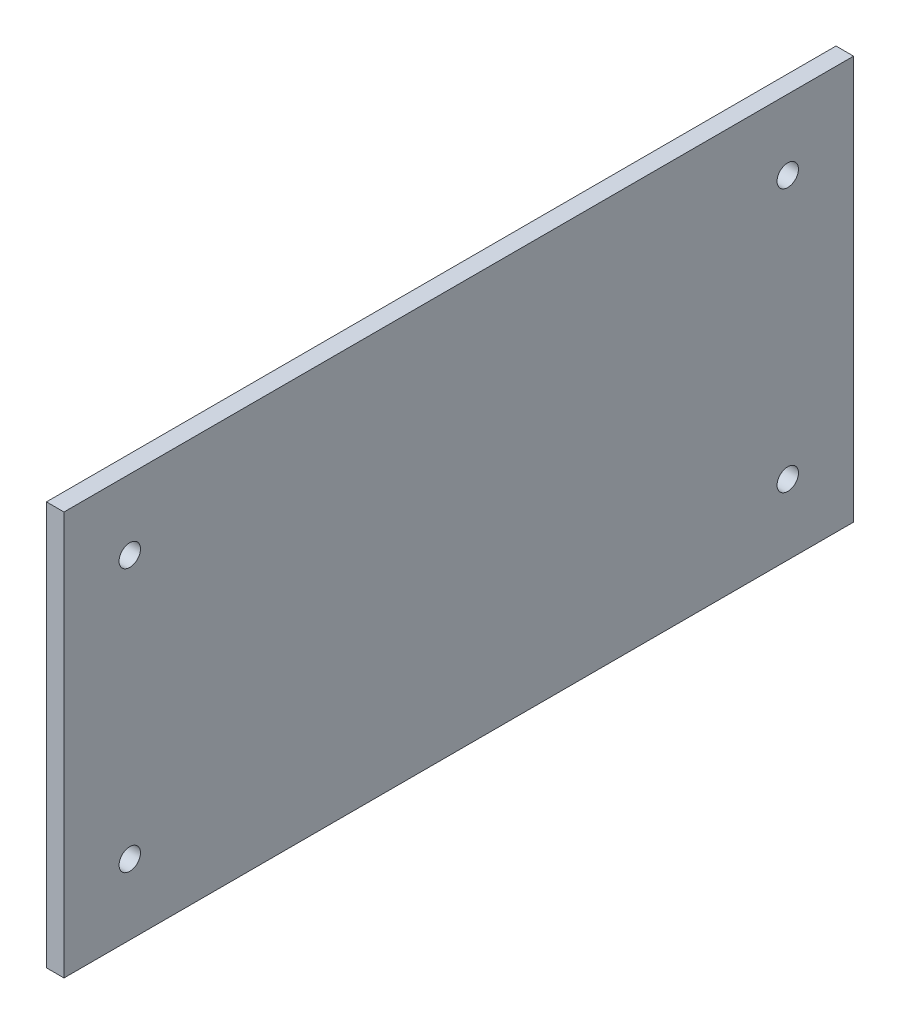
from build123d import *

# Parameters (mm, degrees)
SKETCH1_W                 = 90
SKETCH1_H                 = 46
BOSS_EXTRUDE1_DEPTH       = 2
F_2_CLEARANCE_HOLE1_D     = 2.4384
F_2_CLEARANCE_HOLE1_DEPTH = 3
F_2_CLEARANCE_HOLE1_TIP   = 0.732569267


with BuildPart() as part:
    # Sketch1 → Boss-Extrude1 (new body)
    with BuildSketch(Plane(origin=(0, 0, 0), x_dir=(0, 0, -1), z_dir=(1, 0, 0))):
        Rectangle(SKETCH1_W, SKETCH1_H)
    extrude(amount=BOSS_EXTRUDE1_DEPTH)

    # #2 Clearance Hole1
    with Locations(Plane(origin=(2, 0, 0), x_dir=(0, 0, -1), z_dir=(1, 0, 0))):
        with Locations((-37.5, 15), (-37.5, -15), (37.5, -15), (37.5, 15)):
            Hole(F_2_CLEARANCE_HOLE1_D / 2, depth=F_2_CLEARANCE_HOLE1_DEPTH)
            with Locations((0, 0, -(F_2_CLEARANCE_HOLE1_DEPTH + F_2_CLEARANCE_HOLE1_TIP / 2))):  # 118° drill point
                Cone(0, F_2_CLEARANCE_HOLE1_D / 2, F_2_CLEARANCE_HOLE1_TIP, mode=Mode.SUBTRACT)


solid = part.part
